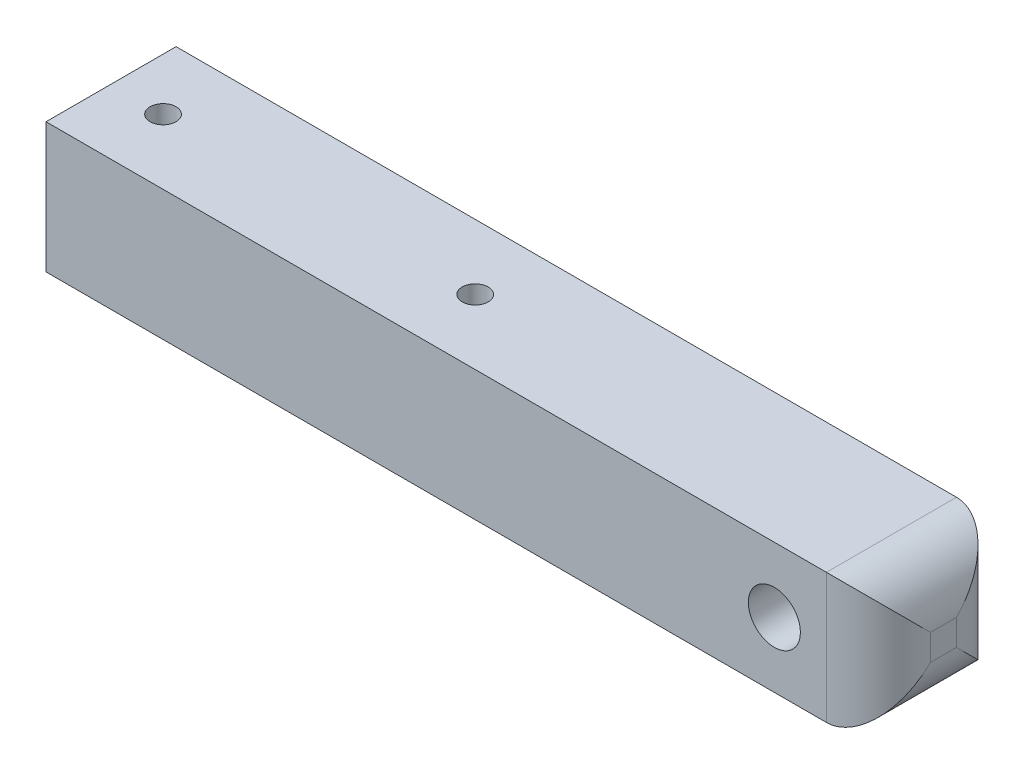
from build123d import *

# Parameters (mm, degrees)
BOSS_EXTRUDE1_DEPTH         = 15.875
CUT_EXTRUDE1_DEPTH          = 152.4
F_1_2_0_5_DIAMETER_HOLE1_D  = 12.7
F_1_4_0_25_DIAMETER_HOLE1_D = 6.35
FILLET1_R                   = 12.7


with BuildPart() as part:
    # Sketch1 → Boss-Extrude1 (new, symmetric)
    with BuildSketch(Plane.XY):
        Polygon((0, 0), (101.6, 0), (101.6, 31.75), (-101.6, 31.75), (-101.6, 0), align=None)
    extrude(amount=BOSS_EXTRUDE1_DEPTH, both=True)

    # Sketch2 → Cut-Extrude1 (cut)
    with BuildSketch(Plane.ZY.offset(101.6)):
        Polygon((0, 4.971051224), (-8.980256121, 13.951307345), (-9.878281733, 13.053281733), (0, 3.175), (9.878281733, 13.053281733), (8.980256121, 13.951307345), align=None)
    extrude(amount=-CUT_EXTRUDE1_DEPTH, mode=Mode.SUBTRACT)

    # 1/2 (0.5) Diameter Hole1 (through all)
    with Locations(Plane.XY.offset(15.875)):
        with Locations((76.2, 15.875)):
            Hole(F_1_2_0_5_DIAMETER_HOLE1_D / 2)

    # 1/4 (0.25) Diameter Hole1 (through all)
    with Locations(Plane(origin=(0, 31.75, 0), x_dir=(1, 0, 0), z_dir=(0, 1, 0))):
        with Locations((-88.9, 0), (-12.7, 0)):
            Hole(F_1_4_0_25_DIAMETER_HOLE1_D / 2)

    # Fillet1
    fillet1_edges = [part.edges().sort_by_distance(p)[0] for p in [
        (101.6, 0, 0),
        (101.6, 15.875, -15.875),
        (101.6, 31.75, 0),
        (101.6, 15.875, 15.875),
    ]]
    fillet(fillet1_edges, radius=FILLET1_R)


solid = part.part
